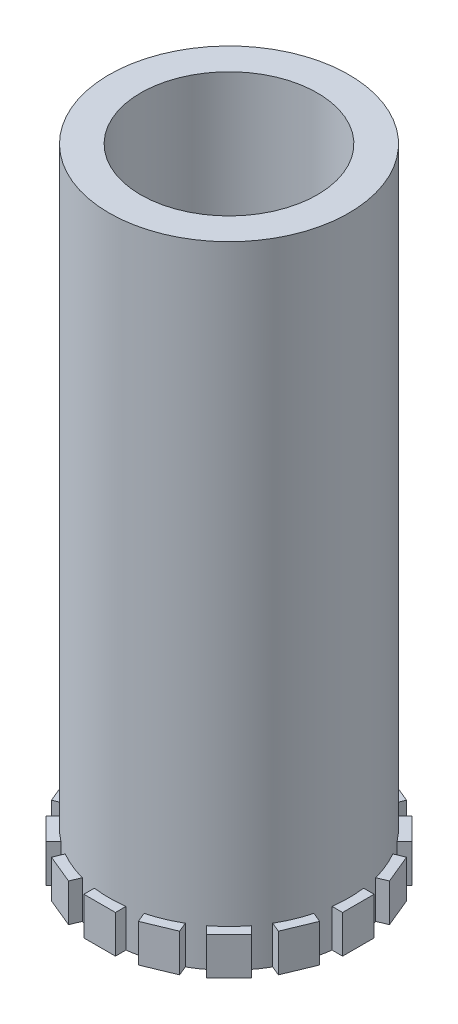
from build123d import *

# Parameters (mm, degrees)
SKETCH_1_R               = 9.5
SKETCH_1_R_2             = 7
EXTRUDE_1_DEPTH          = 50
SKETCH_2_W               = 1.5
SKETCH_2_H               = 2.5
EXTRUDE_2_DEPTH          = 3
PATTERN_CIRCULAR_1_COUNT = 16


with BuildPart() as part:
    # 草图1 → 凸台-拉伸1 (new body)
    with BuildSketch(Plane(origin=(0, 0, 0), x_dir=(1, 0, 0), z_dir=(0, 1, 0))):
        Circle(SKETCH_1_R)
        Circle(SKETCH_1_R_2, mode=Mode.SUBTRACT)
    extrude(amount=EXTRUDE_1_DEPTH)

    # 草图2 → 凸台-拉伸2 (add)
    with BuildSketch(Plane(origin=(0, 0, 0), x_dir=(-1, 0, 0), z_dir=(0, -1, 0))):
        with Locations((9.5, 0)):
            Rectangle(SKETCH_2_W, SKETCH_2_H)
    extrude_2 = extrude(amount=-EXTRUDE_2_DEPTH)

    # 阵列(圆周)1: 凸台-拉伸2 ×16 about axis
    pattern_circular_1_axis = Axis((0, 50, 0), (0, -1, 0))
    for i in range(1, PATTERN_CIRCULAR_1_COUNT):
        add(extrude_2.rotate(pattern_circular_1_axis, i * 360 / PATTERN_CIRCULAR_1_COUNT))


solid = part.part
